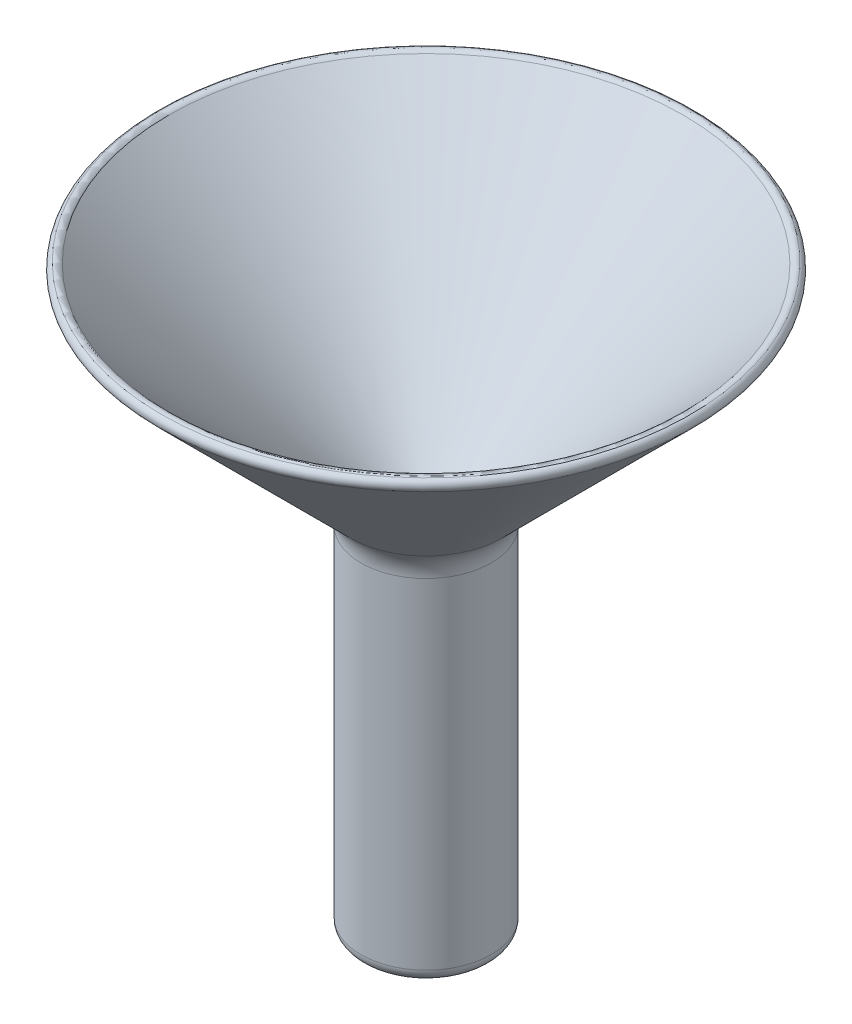
from build123d import *

# Parameters (mm, degrees)
SKETCH_2_W   = 1.3
SKETCH_2_H   = 0.6
SKETCH_2_H_2 = 5
SKETCH_2_H_3 = 0.8
FILLET_2_R   = 1
FILLET_3_R   = 1
FILLET_4_R   = 0.5


with BuildPart() as part:
    # Эскиз2 → Повернуть8 (revolve)
    with BuildSketch(Plane.XY, mode=Mode.PRIVATE) as revolve_8_sk:
        with BuildLine():
            Line((2.1, 14.814213562), (2.1, 14.4))
            Line((2.1, 14.4), (3.1, 14.4))
            Line((3.1, 14.4), (3.7, 15))
            Line((3.7, 15), (3.7, 11.4))
            Line((3.7, 11.4), (5, 11.4))
            Line((5, 11.4), (5, 15.057359313))
            ThreePointArc((5, 15.057359313), (5.228361402, 16.20540961), (5.878679656, 17.178679656))
            Line((5.878679656, 17.178679656), (21, 32.3))
            Line((21, 32.3), (20, 32.714213562))
            Line((20, 32.714213562), (2.1, 14.814213562))
        make_face()
        with BuildLine():
            Line((2.1, 14.4), (2.1, 0))
            Line((2.1, 0), (2.1, -5))
            ThreePointArc((2.1, -5), (2.692582404, -4.077032961), (2.9, -3))
            Line((2.9, -3), (2.9, 0))
            Line((2.9, 0), (2.9, 5))
            ThreePointArc((2.9, 5), (2.900390339, 5.024987802), (2.901560976, 5.04995122))
            Line((2.901560976, 5.04995122), (3.1, 11.4))
            Line((3.1, 11.4), (3.1, 14.4))
            Line((3.1, 14.4), (2.1, 14.4))
        make_face()
        with Locations((4.35, 11.1)):
            Rectangle(SKETCH_2_W, SKETCH_2_H)
        with Locations((4.35, 8.3)):
            Rectangle(SKETCH_2_W, SKETCH_2_H_2)
        with Locations((4.35, 5.4)):
            Rectangle(SKETCH_2_W, SKETCH_2_H_3)
        with BuildLine():
            ThreePointArc((3.250170339, -4.987520547), (3.586248648, -3.975312617), (3.7, -2.91485321))
            Line((3.7, -2.91485321), (3.7, 0))
            Line((3.7, 0), (3.7, 5))
            Line((3.7, 5), (5, 5))
            Line((5, 5), (5, 0))
            Line((5, 0), (5, -12))
            Line((5, -12), (2.6, -12))
            Line((2.6, -12), (2.6, -7.5))
            ThreePointArc((2.6, -7.5), (2.713751352, -6.439540593), (3.049829661, -5.427332663))
            Line((3.049829661, -5.427332663), (3.250170339, -4.987520547))
        make_face()
    revolve(revolve_8_sk.sketch.rotate(Axis((0, 0, 0), (0, 1, 0)), 90), axis=Axis((0, 0, 0), (0, 1, 0)))

    # Скругление2
    fillet_2_edges = [part.edges().sort_by_distance(p)[0] for p in [
        (0, -12, 5),
    ]]
    fillet(fillet_2_edges, radius=FILLET_2_R)

    # Скругление3
    fillet_3_edges = [part.edges().sort_by_distance(p)[0] for p in [
        (0, 14.814213562, 2.1),
    ]]
    fillet(fillet_3_edges, radius=FILLET_3_R)

    # Скругление4
    fillet_4_edges = [part.edges().sort_by_distance(p)[0] for p in [
        (0, 32.714213562, 20),
        (0, 32.3, 21),
    ]]
    fillet(fillet_4_edges, radius=FILLET_4_R - 0.0001)  # a hair under: the kernel refuses the full size


solid = part.part
